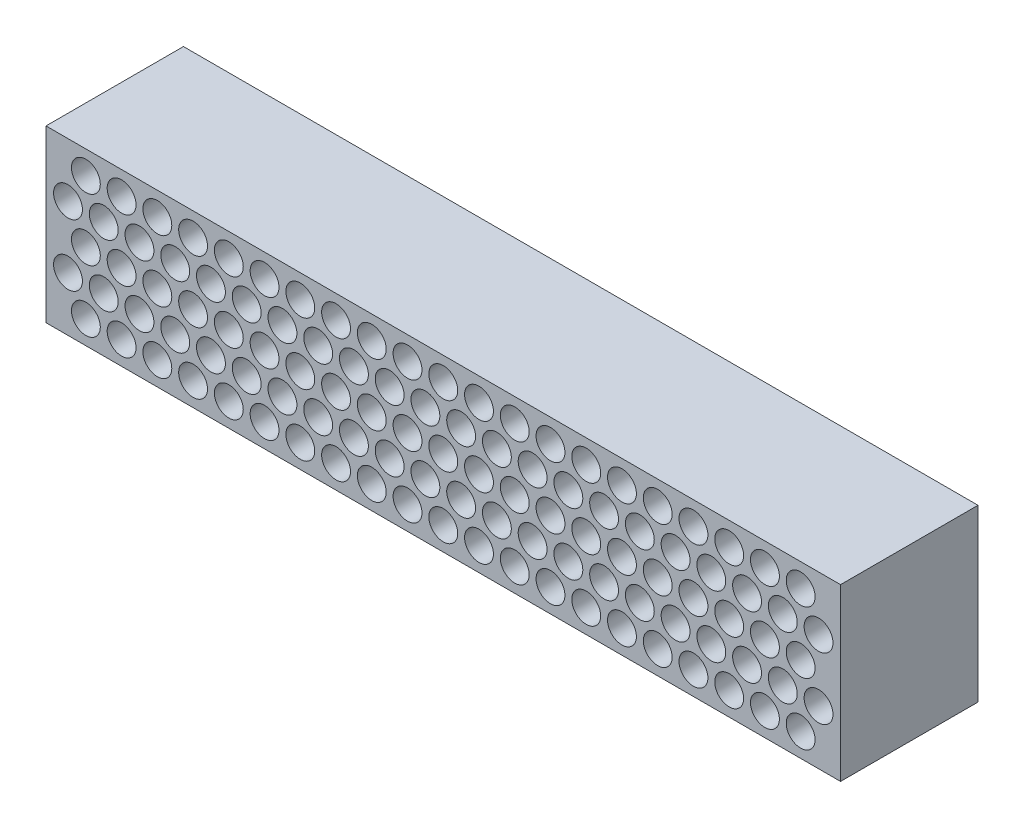
from build123d import *

# Parameters (mm, degrees)
SKETCH1_W               = 28.9
SKETCH1_H               = 5.8
BOSS_EXTRUDE1_DEPTH     = 2.5
CUT_EXTRUDE1_DEPTH      = 15.948662147
CUT_EXTRUDE1_DEPTH_BACK = 15.948662147
SKETCH2_R               = 0.525
FILL_START              = -2.5
FILL_PATTERN1_OUTLINE_R = 0.525
FILL_PATTERN1_DEPTH     = 5
SKETCH4_W               = 28.9
SKETCH4_H               = 0.2
BOSS_EXTRUDE2_DEPTH     = 2.5


# Read off the part's stored shape, not the designer's step: Fill Pattern1
with BuildPart() as part:
    # Sketch1 → Boss-Extrude1 (new, symmetric)
    with BuildSketch(Plane.XY):
        Rectangle(SKETCH1_W, SKETCH1_H)
    extrude(amount=BOSS_EXTRUDE1_DEPTH, both=True)

    # Sketch2 → Cut-Extrude1 (cut, two sides: drawn at the far end of the back side and taken through both)
    with BuildSketch(Plane.XY.offset(-CUT_EXTRUDE1_DEPTH_BACK)):
        Circle(SKETCH2_R)
    extrude(amount=CUT_EXTRUDE1_DEPTH + CUT_EXTRUDE1_DEPTH_BACK, mode=Mode.SUBTRACT)

    # Fill Pattern1 outline → Fill Pattern1 (cut)
    with BuildSketch(Plane.XY.offset(FILL_START)):
        with Locations((13.65, -1.125833025)):
            Circle(FILL_PATTERN1_OUTLINE_R)
        with Locations((-9.75, -1.125833025)):
            Circle(FILL_PATTERN1_OUTLINE_R)
        with Locations((-9.1, 0)):
            Circle(FILL_PATTERN1_OUTLINE_R)
        with Locations((-8.45, 1.125833025)):
            Circle(FILL_PATTERN1_OUTLINE_R)
        with Locations((-7.8, 2.25166605)):
            Circle(FILL_PATTERN1_OUTLINE_R)
        with Locations((-9.1, -2.25166605)):
            Circle(FILL_PATTERN1_OUTLINE_R)
        with Locations((-8.45, -1.125833025)):
            Circle(FILL_PATTERN1_OUTLINE_R)
        with Locations((-7.8, 0)):
            Circle(FILL_PATTERN1_OUTLINE_R)
        with Locations((-7.15, 1.125833025)):
            Circle(FILL_PATTERN1_OUTLINE_R)
        with Locations((-11.05, 1.125833025)):
            Circle(FILL_PATTERN1_OUTLINE_R)
        with Locations((-10.4, 2.25166605)):
            Circle(FILL_PATTERN1_OUTLINE_R)
        with Locations((-11.7, -2.25166605)):
            Circle(FILL_PATTERN1_OUTLINE_R)
        with Locations((-11.05, -1.125833025)):
            Circle(FILL_PATTERN1_OUTLINE_R)
        with Locations((-10.4, -2.25166605)):
            Circle(FILL_PATTERN1_OUTLINE_R)
        with Locations((-9.1, 2.25166605)):
            Circle(FILL_PATTERN1_OUTLINE_R)
        with Locations((-9.75, 1.125833025)):
            Circle(FILL_PATTERN1_OUTLINE_R)
        with Locations((-10.4, 0)):
            Circle(FILL_PATTERN1_OUTLINE_R)
        with Locations((-5.2, -2.25166605)):
            Circle(FILL_PATTERN1_OUTLINE_R)
        with Locations((-3.9, 2.25166605)):
            Circle(FILL_PATTERN1_OUTLINE_R)
        with Locations((-4.55, 1.125833025)):
            Circle(FILL_PATTERN1_OUTLINE_R)
        with Locations((-5.2, 0)):
            Circle(FILL_PATTERN1_OUTLINE_R)
        with Locations((-4.55, -1.125833025)):
            Circle(FILL_PATTERN1_OUTLINE_R)
        with Locations((-3.9, 0)):
            Circle(FILL_PATTERN1_OUTLINE_R)
        with Locations((-3.25, 1.125833025)):
            Circle(FILL_PATTERN1_OUTLINE_R)
        with Locations((-2.6, 2.25166605)):
            Circle(FILL_PATTERN1_OUTLINE_R)
        with Locations((-6.5, 0)):
            Circle(FILL_PATTERN1_OUTLINE_R)
        with Locations((-7.15, -1.125833025)):
            Circle(FILL_PATTERN1_OUTLINE_R)
        with Locations((-7.8, -2.25166605)):
            Circle(FILL_PATTERN1_OUTLINE_R)
        with Locations((-6.5, 2.25166605)):
            Circle(FILL_PATTERN1_OUTLINE_R)
        with Locations((-5.85, 1.125833025)):
            Circle(FILL_PATTERN1_OUTLINE_R)
        with Locations((-5.2, 2.25166605)):
            Circle(FILL_PATTERN1_OUTLINE_R)
        with Locations((-6.5, -2.25166605)):
            Circle(FILL_PATTERN1_OUTLINE_R)
        with Locations((-5.85, -1.125833025)):
            Circle(FILL_PATTERN1_OUTLINE_R)
        with Locations((-13.65, 1.125833025)):
            Circle(FILL_PATTERN1_OUTLINE_R)
        with Locations((-11.7, 2.25166605)):
            Circle(FILL_PATTERN1_OUTLINE_R)
        with Locations((-13, -2.25166605)):
            Circle(FILL_PATTERN1_OUTLINE_R)
        with Locations((-12.35, -1.125833025)):
            Circle(FILL_PATTERN1_OUTLINE_R)
        with Locations((-11.7, 0)):
            Circle(FILL_PATTERN1_OUTLINE_R)
        with Locations((-13, 2.25166605)):
            Circle(FILL_PATTERN1_OUTLINE_R)
        with Locations((-13.65, -1.125833025)):
            Circle(FILL_PATTERN1_OUTLINE_R)
        with Locations((-13, 0)):
            Circle(FILL_PATTERN1_OUTLINE_R)
        with Locations((-12.35, 1.125833025)):
            Circle(FILL_PATTERN1_OUTLINE_R)
        with Locations((7.15, -1.125833025)):
            Circle(FILL_PATTERN1_OUTLINE_R)
        with Locations((7.8, 0)):
            Circle(FILL_PATTERN1_OUTLINE_R)
        with Locations((8.45, 1.125833025)):
            Circle(FILL_PATTERN1_OUTLINE_R)
        with Locations((9.1, 2.25166605)):
            Circle(FILL_PATTERN1_OUTLINE_R)
        with Locations((7.8, -2.25166605)):
            Circle(FILL_PATTERN1_OUTLINE_R)
        with Locations((8.45, -1.125833025)):
            Circle(FILL_PATTERN1_OUTLINE_R)
        with Locations((9.1, 0)):
            Circle(FILL_PATTERN1_OUTLINE_R)
        with Locations((9.75, 1.125833025)):
            Circle(FILL_PATTERN1_OUTLINE_R)
        with Locations((5.85, 1.125833025)):
            Circle(FILL_PATTERN1_OUTLINE_R)
        with Locations((6.5, 2.25166605)):
            Circle(FILL_PATTERN1_OUTLINE_R)
        with Locations((5.2, -2.25166605)):
            Circle(FILL_PATTERN1_OUTLINE_R)
        with Locations((5.85, -1.125833025)):
            Circle(FILL_PATTERN1_OUTLINE_R)
        with Locations((6.5, -2.25166605)):
            Circle(FILL_PATTERN1_OUTLINE_R)
        with Locations((7.8, 2.25166605)):
            Circle(FILL_PATTERN1_OUTLINE_R)
        with Locations((7.15, 1.125833025)):
            Circle(FILL_PATTERN1_OUTLINE_R)
        with Locations((6.5, 0)):
            Circle(FILL_PATTERN1_OUTLINE_R)
        with Locations((11.7, -2.25166605)):
            Circle(FILL_PATTERN1_OUTLINE_R)
        with Locations((13, 2.25166605)):
            Circle(FILL_PATTERN1_OUTLINE_R)
        with Locations((12.35, 1.125833025)):
            Circle(FILL_PATTERN1_OUTLINE_R)
        with Locations((11.7, 0)):
            Circle(FILL_PATTERN1_OUTLINE_R)
        with Locations((13, -2.25166605)):
            Circle(FILL_PATTERN1_OUTLINE_R)
        with Locations((13.65, 1.125833025)):
            Circle(FILL_PATTERN1_OUTLINE_R)
        with Locations((13, 0)):
            Circle(FILL_PATTERN1_OUTLINE_R)
        with Locations((12.35, -1.125833025)):
            Circle(FILL_PATTERN1_OUTLINE_R)
        with Locations((10.4, 0)):
            Circle(FILL_PATTERN1_OUTLINE_R)
        with Locations((9.75, -1.125833025)):
            Circle(FILL_PATTERN1_OUTLINE_R)
        with Locations((9.1, -2.25166605)):
            Circle(FILL_PATTERN1_OUTLINE_R)
        with Locations((10.4, 2.25166605)):
            Circle(FILL_PATTERN1_OUTLINE_R)
        with Locations((11.05, 1.125833025)):
            Circle(FILL_PATTERN1_OUTLINE_R)
        with Locations((11.7, 2.25166605)):
            Circle(FILL_PATTERN1_OUTLINE_R)
        with Locations((10.4, -2.25166605)):
            Circle(FILL_PATTERN1_OUTLINE_R)
        with Locations((11.05, -1.125833025)):
            Circle(FILL_PATTERN1_OUTLINE_R)
        with Locations((-0.65, 1.125833025)):
            Circle(FILL_PATTERN1_OUTLINE_R)
        with Locations((0, 2.25166605)):
            Circle(FILL_PATTERN1_OUTLINE_R)
        with Locations((-1.3, -2.25166605)):
            Circle(FILL_PATTERN1_OUTLINE_R)
        with Locations((-0.65, -1.125833025)):
            Circle(FILL_PATTERN1_OUTLINE_R)
        with Locations((0.65, 1.125833025)):
            Circle(FILL_PATTERN1_OUTLINE_R)
        with Locations((1.3, 2.25166605)):
            Circle(FILL_PATTERN1_OUTLINE_R)
        with Locations((0, -2.25166605)):
            Circle(FILL_PATTERN1_OUTLINE_R)
        with Locations((0.65, -1.125833025)):
            Circle(FILL_PATTERN1_OUTLINE_R)
        with Locations((-3.9, -2.25166605)):
            Circle(FILL_PATTERN1_OUTLINE_R)
        with Locations((-3.25, -1.125833025)):
            Circle(FILL_PATTERN1_OUTLINE_R)
        with Locations((-2.6, 0)):
            Circle(FILL_PATTERN1_OUTLINE_R)
        with Locations((-1.95, 1.125833025)):
            Circle(FILL_PATTERN1_OUTLINE_R)
        with Locations((-1.3, 0)):
            Circle(FILL_PATTERN1_OUTLINE_R)
        with Locations((-1.95, -1.125833025)):
            Circle(FILL_PATTERN1_OUTLINE_R)
        with Locations((-2.6, -2.25166605)):
            Circle(FILL_PATTERN1_OUTLINE_R)
        with Locations((-1.3, 2.25166605)):
            Circle(FILL_PATTERN1_OUTLINE_R)
        with Locations((2.6, -2.25166605)):
            Circle(FILL_PATTERN1_OUTLINE_R)
        with Locations((3.25, -1.125833025)):
            Circle(FILL_PATTERN1_OUTLINE_R)
        with Locations((3.9, 0)):
            Circle(FILL_PATTERN1_OUTLINE_R)
        with Locations((4.55, 1.125833025)):
            Circle(FILL_PATTERN1_OUTLINE_R)
        with Locations((5.2, 0)):
            Circle(FILL_PATTERN1_OUTLINE_R)
        with Locations((4.55, -1.125833025)):
            Circle(FILL_PATTERN1_OUTLINE_R)
        with Locations((3.9, -2.25166605)):
            Circle(FILL_PATTERN1_OUTLINE_R)
        with Locations((5.2, 2.25166605)):
            Circle(FILL_PATTERN1_OUTLINE_R)
        with Locations((1.3, -2.25166605)):
            Circle(FILL_PATTERN1_OUTLINE_R)
        with Locations((2.6, 2.25166605)):
            Circle(FILL_PATTERN1_OUTLINE_R)
        with Locations((1.95, 1.125833025)):
            Circle(FILL_PATTERN1_OUTLINE_R)
        with Locations((1.3, 0)):
            Circle(FILL_PATTERN1_OUTLINE_R)
        with Locations((1.95, -1.125833025)):
            Circle(FILL_PATTERN1_OUTLINE_R)
        with Locations((2.6, 0)):
            Circle(FILL_PATTERN1_OUTLINE_R)
        with Locations((3.25, 1.125833025)):
            Circle(FILL_PATTERN1_OUTLINE_R)
        with Locations((3.9, 2.25166605)):
            Circle(FILL_PATTERN1_OUTLINE_R)
    extrude(amount=FILL_PATTERN1_DEPTH, mode=Mode.SUBTRACT)

    # Sketch4 → Boss-Extrude2 (add, symmetric)
    with BuildSketch(Plane.XY):
        with Locations((0, 3)):
            Rectangle(SKETCH4_W, SKETCH4_H)
        with Locations((0, -3)):
            Rectangle(SKETCH4_W, SKETCH4_H)
    extrude(amount=BOSS_EXTRUDE2_DEPTH, both=True)


solid = part.part
